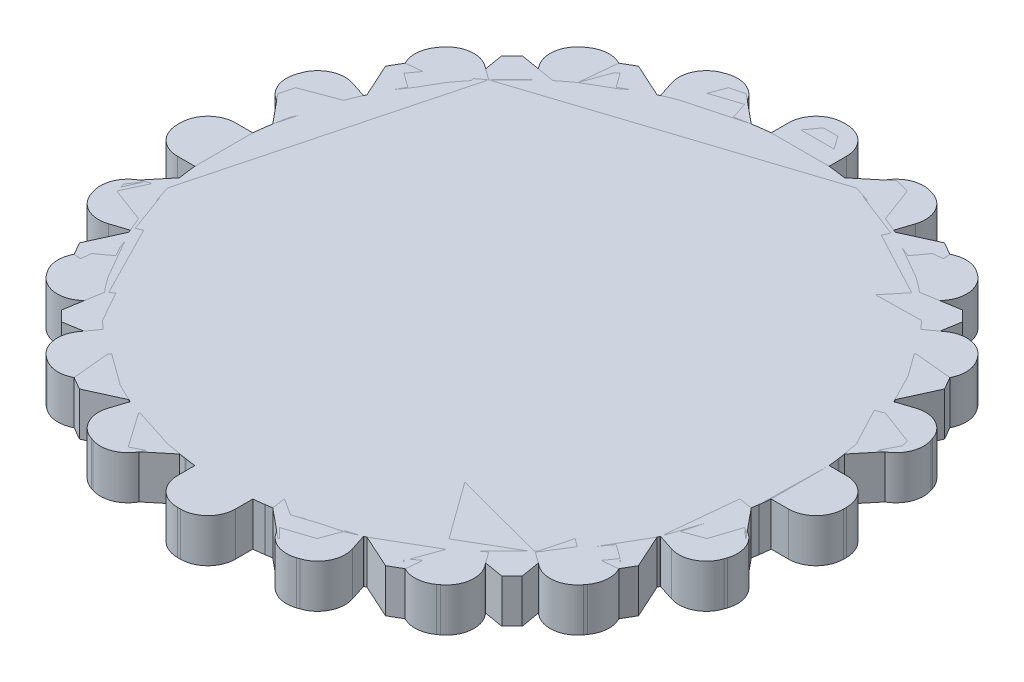
from build123d import *

# Parameters (mm, degrees)
BOSS_EXTRUDE3_DEPTH = 3
BOSS_EXTRUDE5_DEPTH = 3
BOSS_EXTRUDE6_DEPTH = 3
SKETCH4_R           = 4.125
CUT_EXTRUDE1_DEPTH  = 10


with BuildPart() as part:
    # Sketch2 → Boss-Extrude3 (new body)
    with BuildSketch(Plane(origin=(0, 0, 0), x_dir=(1, 0, 0), z_dir=(0, 1, 0))):
        with BuildLine():
            Line((-23, 0.1), (-23, -0.1))
            ThreePointArc((-23, -0.1), (-22.443502884, -1.443502884), (-21.1, -2))
            Line((-21.1, -2), (-19.899748742, -2))
            ThreePointArc((-19.899748742, -2), (-19.753766812, -3.128689301), (-19.543819703, -4.247247513))
            Line((-19.543819703, -4.247247513), (-20.685326483, -4.618145549))
            ThreePointArc((-20.685326483, -4.618145549), (-21.791106589, -5.56257098), (-21.905201574, -7.012285219))
            Line((-21.905201574, -7.012285219), (-21.843398175, -7.202496522))
            ThreePointArc((-21.843398175, -7.202496522), (-20.898972744, -8.308276629), (-19.449258505, -8.422371614))
            Line((-19.449258505, -8.422371614), (-18.307751725, -8.051473578))
            ThreePointArc((-18.307751725, -8.051473578), (-17.820130484, -9.079809995), (-17.274805421, -10.078744846))
            Line((-17.274805421, -10.078744846), (-18.245829086, -10.784234835))
            ThreePointArc((-18.245829086, -10.784234835), (-19.005644954, -12.02414164), (-18.666169396, -13.438159103))
            Line((-18.666169396, -13.438159103), (-18.548612345, -13.599962502))
            ThreePointArc((-18.548612345, -13.599962502), (-17.30870554, -14.35977837), (-15.894688077, -14.020302812))
            Line((-15.894688077, -14.020302812), (-14.923664412, -13.314812824))
            ThreePointArc((-14.923664412, -13.314812824), (-14.142135624, -14.142135624), (-13.314812824, -14.923664412))
            Line((-13.314812824, -14.923664412), (-14.020302812, -15.894688077))
            ThreePointArc((-14.020302812, -15.894688077), (-14.35977837, -17.30870554), (-13.599962502, -18.548612345))
            Line((-13.599962502, -18.548612345), (-13.438159103, -18.666169396))
            ThreePointArc((-13.438159103, -18.666169396), (-12.02414164, -19.005644954), (-10.784234835, -18.245829086))
            Line((-10.784234835, -18.245829086), (-10.078744846, -17.274805421))
            ThreePointArc((-10.078744846, -17.274805421), (-9.079809995, -17.820130484), (-8.051473578, -18.307751725))
            Line((-8.051473578, -18.307751725), (-8.422371614, -19.449258505))
            ThreePointArc((-8.422371614, -19.449258505), (-8.308276629, -20.898972744), (-7.202496522, -21.843398175))
            Line((-7.202496522, -21.843398175), (-7.012285219, -21.905201574))
            ThreePointArc((-7.012285219, -21.905201574), (-5.56257098, -21.791106589), (-4.618145549, -20.685326483))
            Line((-4.618145549, -20.685326483), (-4.247247513, -19.543819703))
            ThreePointArc((-4.247247513, -19.543819703), (-3.128689301, -19.753766812), (-2, -19.899748742))
            Line((-2, -19.899748742), (-2, -21.1))
            ThreePointArc((-2, -21.1), (-1.443502884, -22.443502884), (-0.1, -23))
            Line((-0.1, -23), (0.1, -23))
            ThreePointArc((0.1, -23), (1.443502884, -22.443502884), (2, -21.1))
            Line((2, -21.1), (2, -19.899748742))
            ThreePointArc((2, -19.899748742), (3.128689301, -19.753766812), (4.247247513, -19.543819703))
            Line((4.247247513, -19.543819703), (4.618145549, -20.685326483))
            ThreePointArc((4.618145549, -20.685326483), (5.56257098, -21.791106589), (7.012285219, -21.905201574))
            Line((7.012285219, -21.905201574), (7.202496522, -21.843398175))
            ThreePointArc((7.202496522, -21.843398175), (8.308276629, -20.898972744), (8.422371614, -19.449258505))
            Line((8.422371614, -19.449258505), (8.051473578, -18.307751725))
            ThreePointArc((8.051473578, -18.307751725), (9.079809995, -17.820130484), (10.078744846, -17.274805421))
            Line((10.078744846, -17.274805421), (10.784234835, -18.245829086))
            ThreePointArc((10.784234835, -18.245829086), (12.02414164, -19.005644954), (13.438159103, -18.666169396))
            Line((13.438159103, -18.666169396), (13.599962502, -18.548612345))
            ThreePointArc((13.599962502, -18.548612345), (14.35977837, -17.30870554), (14.020302812, -15.894688077))
            Line((14.020302812, -15.894688077), (13.314812824, -14.923664412))
            ThreePointArc((13.314812824, -14.923664412), (14.142135624, -14.142135624), (14.923664412, -13.314812824))
            Line((14.923664412, -13.314812824), (15.894688077, -14.020302812))
            ThreePointArc((15.894688077, -14.020302812), (17.30870554, -14.35977837), (18.548612345, -13.599962502))
            Line((18.548612345, -13.599962502), (18.666169396, -13.438159103))
            ThreePointArc((18.666169396, -13.438159103), (19.005644954, -12.02414164), (18.245829086, -10.784234835))
            Line((18.245829086, -10.784234835), (17.274805421, -10.078744846))
            ThreePointArc((17.274805421, -10.078744846), (17.820130484, -9.079809995), (18.307751725, -8.051473578))
            Line((18.307751725, -8.051473578), (19.449258505, -8.422371614))
            ThreePointArc((19.449258505, -8.422371614), (20.898972744, -8.308276629), (21.843398175, -7.202496522))
            Line((21.843398175, -7.202496522), (21.905201574, -7.012285219))
            ThreePointArc((21.905201574, -7.012285219), (21.791106589, -5.56257098), (20.685326483, -4.618145549))
            Line((20.685326483, -4.618145549), (19.543819703, -4.247247513))
            ThreePointArc((19.543819703, -4.247247513), (19.753766812, -3.128689301), (19.899748742, -2))
            Line((19.899748742, -2), (21.1, -2))
            ThreePointArc((21.1, -2), (22.443502884, -1.443502884), (23, -0.1))
            Line((23, -0.1), (23, 0.1))
            ThreePointArc((23, 0.1), (22.443502884, 1.443502884), (21.1, 2))
            Line((21.1, 2), (19.899748742, 2))
            ThreePointArc((19.899748742, 2), (19.753766812, 3.128689301), (19.543819703, 4.247247513))
            Line((19.543819703, 4.247247513), (20.685326483, 4.618145549))
            ThreePointArc((20.685326483, 4.618145549), (21.791106589, 5.56257098), (21.905201574, 7.012285219))
            Line((21.905201574, 7.012285219), (21.843398175, 7.202496522))
            ThreePointArc((21.843398175, 7.202496522), (20.898972744, 8.308276629), (19.449258505, 8.422371614))
            Line((19.449258505, 8.422371614), (18.307751725, 8.051473578))
            ThreePointArc((18.307751725, 8.051473578), (17.820130484, 9.079809995), (17.274805421, 10.078744846))
            Line((17.274805421, 10.078744846), (18.245829086, 10.784234835))
            ThreePointArc((18.245829086, 10.784234835), (19.005644954, 12.02414164), (18.666169396, 13.438159103))
            Line((18.666169396, 13.438159103), (18.548612345, 13.599962502))
            ThreePointArc((18.548612345, 13.599962502), (17.30870554, 14.35977837), (15.894688077, 14.020302812))
            Line((15.894688077, 14.020302812), (14.923664412, 13.314812824))
            ThreePointArc((14.923664412, 13.314812824), (14.142135624, 14.142135624), (13.314812824, 14.923664412))
            Line((13.314812824, 14.923664412), (14.020302812, 15.894688077))
            ThreePointArc((14.020302812, 15.894688077), (14.35977837, 17.30870554), (13.599962502, 18.548612345))
            Line((13.599962502, 18.548612345), (13.438159103, 18.666169396))
            ThreePointArc((13.438159103, 18.666169396), (12.02414164, 19.005644954), (10.784234835, 18.245829086))
            Line((10.784234835, 18.245829086), (10.078744846, 17.274805421))
            ThreePointArc((10.078744846, 17.274805421), (9.079809995, 17.820130484), (8.051473578, 18.307751725))
            Line((8.051473578, 18.307751725), (8.422371614, 19.449258505))
            ThreePointArc((8.422371614, 19.449258505), (8.308276629, 20.898972744), (7.202496522, 21.843398175))
            Line((7.202496522, 21.843398175), (7.012285219, 21.905201574))
            ThreePointArc((7.012285219, 21.905201574), (5.56257098, 21.791106589), (4.618145549, 20.685326483))
            Line((4.618145549, 20.685326483), (4.247247513, 19.543819703))
            ThreePointArc((4.247247513, 19.543819703), (3.128689301, 19.753766812), (2, 19.899748742))
            Line((2, 19.899748742), (2, 21.1))
            ThreePointArc((2, 21.1), (1.443502884, 22.443502884), (0.1, 23))
            Line((0.1, 23), (-0.1, 23))
            ThreePointArc((-0.1, 23), (-1.443502884, 22.443502884), (-2, 21.1))
            Line((-2, 21.1), (-2, 19.899748742))
            ThreePointArc((-2, 19.899748742), (-3.128689301, 19.753766812), (-4.247247513, 19.543819703))
            Line((-4.247247513, 19.543819703), (-4.618145549, 20.685326483))
            ThreePointArc((-4.618145549, 20.685326483), (-5.56257098, 21.791106589), (-7.012285219, 21.905201574))
            Line((-7.012285219, 21.905201574), (-7.202496522, 21.843398175))
            ThreePointArc((-7.202496522, 21.843398175), (-8.308276629, 20.898972744), (-8.422371614, 19.449258505))
            Line((-8.422371614, 19.449258505), (-8.051473578, 18.307751725))
            ThreePointArc((-8.051473578, 18.307751725), (-9.079809995, 17.820130484), (-10.078744846, 17.274805421))
            Line((-10.078744846, 17.274805421), (-10.784234835, 18.245829086))
            ThreePointArc((-10.784234835, 18.245829086), (-12.02414164, 19.005644954), (-13.438159103, 18.666169396))
            Line((-13.438159103, 18.666169396), (-13.599962502, 18.548612345))
            ThreePointArc((-13.599962502, 18.548612345), (-14.35977837, 17.30870554), (-14.020302812, 15.894688077))
            Line((-14.020302812, 15.894688077), (-13.314812824, 14.923664412))
            ThreePointArc((-13.314812824, 14.923664412), (-14.142135624, 14.142135624), (-14.923664412, 13.314812824))
            Line((-14.923664412, 13.314812824), (-15.894688077, 14.020302812))
            ThreePointArc((-15.894688077, 14.020302812), (-17.30870554, 14.35977837), (-18.548612345, 13.599962502))
            Line((-18.548612345, 13.599962502), (-18.666169396, 13.438159103))
            ThreePointArc((-18.666169396, 13.438159103), (-19.005644954, 12.02414164), (-18.245829086, 10.784234835))
            Line((-18.245829086, 10.784234835), (-17.274805421, 10.078744846))
            ThreePointArc((-17.274805421, 10.078744846), (-17.820130484, 9.079809995), (-18.307751725, 8.051473578))
            Line((-18.307751725, 8.051473578), (-19.449258505, 8.422371614))
            ThreePointArc((-19.449258505, 8.422371614), (-20.898972744, 8.308276629), (-21.843398175, 7.202496522))
            Line((-21.843398175, 7.202496522), (-21.905201574, 7.012285219))
            ThreePointArc((-21.905201574, 7.012285219), (-21.791106589, 5.56257098), (-20.685326483, 4.618145549))
            Line((-20.685326483, 4.618145549), (-19.543819703, 4.247247513))
            ThreePointArc((-19.543819703, 4.247247513), (-19.753766812, 3.128689301), (-19.899748742, 2))
            Line((-19.899748742, 2), (-21.1, 2))
            ThreePointArc((-21.1, 2), (-22.443502884, 1.443502884), (-23, 0.1))
        make_face()
    extrude(amount=BOSS_EXTRUDE3_DEPTH)


with BuildPart() as body_2:
    # Sketch3 → Boss-Extrude5 (new body)
    with BuildSketch(Plane(origin=(0, 0, 0), x_dir=(1, 0, 0), z_dir=(0, 1, 0))):
        with BuildLine():
            Line((-22, 0.5), (-22, -0.5))
            Line((-22, -0.5), (-19.899748742, -2))
            ThreePointArc((-19.899748742, -2), (-19.828897227, -2.610523844), (-19.739319337, -3.218582315))
            Line((-19.739319337, -3.218582315), (-21.379777701, -5.211056079))
            Line((-21.379777701, -5.211056079), (-21.120958656, -6.176981905))
            Line((-21.120958656, -6.176981905), (-18.704043156, -7.08228562))
            ThreePointArc((-18.704043156, -7.08228562), (-18.47759065, -7.653668647), (-18.23368794, -8.217823563))
            Line((-18.23368794, -8.217823563), (-19.302558883, -10.566987298))
            Line((-19.302558883, -10.566987298), (-18.802558883, -11.433012702))
            Line((-18.802558883, -11.433012702), (-16.23368794, -11.681925179))
            ThreePointArc((-16.23368794, -11.681925179), (-15.867066806, -12.17522858), (-15.485460842, -12.657033717))
            Line((-15.485460842, -12.657033717), (-15.909902577, -15.202795796))
            Line((-15.909902577, -15.202795796), (-15.202795796, -15.909902577))
            Line((-15.202795796, -15.909902577), (-12.657033717, -15.485460842))
            ThreePointArc((-12.657033717, -15.485460842), (-12.17522858, -15.867066806), (-11.681925179, -16.23368794))
            Line((-11.681925179, -16.23368794), (-11.433012702, -18.802558883))
            Line((-11.433012702, -18.802558883), (-10.566987298, -19.302558883))
            Line((-10.566987298, -19.302558883), (-8.217823563, -18.23368794))
            ThreePointArc((-8.217823563, -18.23368794), (-7.653668647, -18.47759065), (-7.08228562, -18.704043156))
            Line((-7.08228562, -18.704043156), (-6.176981905, -21.120958656))
            Line((-6.176981905, -21.120958656), (-5.211056079, -21.379777701))
            Line((-5.211056079, -21.379777701), (-3.218582315, -19.739319337))
            ThreePointArc((-3.218582315, -19.739319337), (-2.610523844, -19.828897227), (-2, -19.899748742))
            Line((-2, -19.899748742), (-0.5, -22))
            Line((-0.5, -22), (0.5, -22))
            Line((0.5, -22), (2, -19.899748742))
            ThreePointArc((2, -19.899748742), (2.610523844, -19.828897227), (3.218582315, -19.739319337))
            Line((3.218582315, -19.739319337), (5.211056079, -21.379777701))
            Line((5.211056079, -21.379777701), (6.176981905, -21.120958656))
            Line((6.176981905, -21.120958656), (7.08228562, -18.704043156))
            ThreePointArc((7.08228562, -18.704043156), (7.653668647, -18.47759065), (8.217823563, -18.23368794))
            Line((8.217823563, -18.23368794), (10.566987298, -19.302558883))
            Line((10.566987298, -19.302558883), (11.433012702, -18.802558883))
            Line((11.433012702, -18.802558883), (11.681925179, -16.23368794))
            ThreePointArc((11.681925179, -16.23368794), (12.17522858, -15.867066806), (12.657033717, -15.485460842))
            Line((12.657033717, -15.485460842), (15.202795796, -15.909902577))
            Line((15.202795796, -15.909902577), (15.909902577, -15.202795796))
            Line((15.909902577, -15.202795796), (15.485460842, -12.657033717))
            ThreePointArc((15.485460842, -12.657033717), (15.867066806, -12.17522858), (16.23368794, -11.681925179))
            Line((16.23368794, -11.681925179), (18.802558883, -11.433012702))
            Line((18.802558883, -11.433012702), (19.302558883, -10.566987298))
            Line((19.302558883, -10.566987298), (18.23368794, -8.217823563))
            ThreePointArc((18.23368794, -8.217823563), (18.47759065, -7.653668647), (18.704043156, -7.08228562))
            Line((18.704043156, -7.08228562), (21.120958656, -6.176981905))
            Line((21.120958656, -6.176981905), (21.379777701, -5.211056079))
            Line((21.379777701, -5.211056079), (19.739319337, -3.218582315))
            ThreePointArc((19.739319337, -3.218582315), (19.828897227, -2.610523844), (19.899748742, -2))
            Line((19.899748742, -2), (22, -0.5))
            Line((22, -0.5), (22, 0.5))
            Line((22, 0.5), (19.899748742, 2))
            ThreePointArc((19.899748742, 2), (19.828897227, 2.610523844), (19.739319337, 3.218582315))
            Line((19.739319337, 3.218582315), (21.379777701, 5.211056079))
            Line((21.379777701, 5.211056079), (21.120958656, 6.176981905))
            Line((21.120958656, 6.176981905), (18.704043156, 7.08228562))
            ThreePointArc((18.704043156, 7.08228562), (18.47759065, 7.653668647), (18.23368794, 8.217823563))
            Line((18.23368794, 8.217823563), (19.302558883, 10.566987298))
            Line((19.302558883, 10.566987298), (18.802558883, 11.433012702))
            Line((18.802558883, 11.433012702), (16.23368794, 11.681925179))
            ThreePointArc((16.23368794, 11.681925179), (15.867066806, 12.17522858), (15.485460842, 12.657033717))
            Line((15.485460842, 12.657033717), (15.909902577, 15.202795796))
            Line((15.909902577, 15.202795796), (15.202795796, 15.909902577))
            Line((15.202795796, 15.909902577), (12.657033717, 15.485460842))
            ThreePointArc((12.657033717, 15.485460842), (12.17522858, 15.867066806), (11.681925179, 16.23368794))
            Line((11.681925179, 16.23368794), (11.433012702, 18.802558883))
            Line((11.433012702, 18.802558883), (10.566987298, 19.302558883))
            Line((10.566987298, 19.302558883), (8.217823563, 18.23368794))
            ThreePointArc((8.217823563, 18.23368794), (7.653668647, 18.47759065), (7.08228562, 18.704043156))
            Line((7.08228562, 18.704043156), (6.176981905, 21.120958656))
            Line((6.176981905, 21.120958656), (5.211056079, 21.379777701))
            Line((5.211056079, 21.379777701), (3.218582315, 19.739319337))
            ThreePointArc((3.218582315, 19.739319337), (2.610523844, 19.828897227), (2, 19.899748742))
            Line((2, 19.899748742), (0.5, 22))
            Line((0.5, 22), (-0.5, 22))
            Line((-0.5, 22), (-2, 19.899748742))
            ThreePointArc((-2, 19.899748742), (-2.610523844, 19.828897227), (-3.218582315, 19.739319337))
            Line((-3.218582315, 19.739319337), (-5.211056079, 21.379777701))
            Line((-5.211056079, 21.379777701), (-6.176981905, 21.120958656))
            Line((-6.176981905, 21.120958656), (-7.08228562, 18.704043156))
            ThreePointArc((-7.08228562, 18.704043156), (-7.653668647, 18.47759065), (-8.217823563, 18.23368794))
            Line((-8.217823563, 18.23368794), (-10.566987298, 19.302558883))
            Line((-10.566987298, 19.302558883), (-11.433012702, 18.802558883))
            Line((-11.433012702, 18.802558883), (-11.681925179, 16.23368794))
            ThreePointArc((-11.681925179, 16.23368794), (-12.17522858, 15.867066806), (-12.657033717, 15.485460842))
            Line((-12.657033717, 15.485460842), (-15.202795796, 15.909902577))
            Line((-15.202795796, 15.909902577), (-15.909902577, 15.202795796))
            Line((-15.909902577, 15.202795796), (-15.485460842, 12.657033717))
            ThreePointArc((-15.485460842, 12.657033717), (-15.867066806, 12.17522858), (-16.23368794, 11.681925179))
            Line((-16.23368794, 11.681925179), (-18.802558883, 11.433012702))
            Line((-18.802558883, 11.433012702), (-19.302558883, 10.566987298))
            Line((-19.302558883, 10.566987298), (-18.23368794, 8.217823563))
            ThreePointArc((-18.23368794, 8.217823563), (-18.47759065, 7.653668647), (-18.704043156, 7.08228562))
            Line((-18.704043156, 7.08228562), (-21.120958656, 6.176981905))
            Line((-21.120958656, 6.176981905), (-21.379777701, 5.211056079))
            Line((-21.379777701, 5.211056079), (-19.739319337, 3.218582315))
            ThreePointArc((-19.739319337, 3.218582315), (-19.828897227, 2.610523844), (-19.899748742, 2))
            Line((-19.899748742, 2), (-22, 0.5))
        make_face()
    extrude(amount=BOSS_EXTRUDE5_DEPTH)

    # Sketch4 → Cut-Extrude1 (cut)
    with BuildSketch(Plane(origin=(0, 3, 0), x_dir=(1, 0, 0), z_dir=(0, 1, 0))):
        Circle(SKETCH4_R)
    extrude(amount=-CUT_EXTRUDE1_DEPTH, mode=Mode.SUBTRACT)


with BuildPart() as body_3:
    # Sketch1 → Boss-Extrude6 (new body)
    with BuildSketch(Plane(origin=(0, 0, 0), x_dir=(1, 0, 0), z_dir=(0, 1, 0))):
        with BuildLine():
            Line((-0.5, 14.746169466), (0.5, 14.746169466))
            Line((0.5, 14.746169466), (2, 12.544128437))
            ThreePointArc((2, 12.544128437), (2.588190451, 12.405427729), (3.166928678, 12.23145084))
            Line((3.166928678, 12.23145084), (5.566987298, 13.388474311))
            Line((5.566987298, 13.388474311), (6.433012702, 12.888474311))
            Line((6.433012702, 12.888474311), (6.631030293, 10.23145084))
            ThreePointArc((6.631030293, 10.23145084), (7.071067812, 9.817237278), (7.485281374, 9.377199759))
            Line((7.485281374, 9.377199759), (10.142304845, 9.179182168))
            Line((10.142304845, 9.179182168), (10.642304845, 8.313156764))
            Line((10.642304845, 8.313156764), (9.485281374, 5.913098144))
            ThreePointArc((9.485281374, 5.913098144), (9.659258263, 5.334359917), (9.797958971, 4.746169466))
            Line((9.797958971, 4.746169466), (12, 3.246169466))
            Line((12, 3.246169466), (12, 2.246169466))
            Line((12, 2.246169466), (9.797958971, 0.746169466))
            ThreePointArc((9.797958971, 0.746169466), (9.659258263, 0.157979015), (9.485281374, -0.420759212))
            Line((9.485281374, -0.420759212), (10.642304845, -2.820817832))
            Line((10.642304845, -2.820817832), (10.142304845, -3.686843236))
            Line((10.142304845, -3.686843236), (7.485281374, -3.884860827))
            ThreePointArc((7.485281374, -3.884860827), (7.071067812, -4.324898346), (6.631030293, -4.739111908))
            Line((6.631030293, -4.739111908), (6.433012702, -7.39613538))
            Line((6.433012702, -7.39613538), (5.566987298, -7.89613538))
            Line((5.566987298, -7.89613538), (3.166928678, -6.739111908))
            ThreePointArc((3.166928678, -6.739111908), (2.588190451, -6.913088797), (2, -7.051789505))
            Line((2, -7.051789505), (0.5, -9.253830534))
            Line((0.5, -9.253830534), (-0.5, -9.253830534))
            Line((-0.5, -9.253830534), (-2, -7.051789505))
            ThreePointArc((-2, -7.051789505), (-2.588190451, -6.913088797), (-3.166928678, -6.739111908))
            Line((-3.166928678, -6.739111908), (-5.566987298, -7.89613538))
            Line((-5.566987298, -7.89613538), (-6.433012702, -7.39613538))
            Line((-6.433012702, -7.39613538), (-6.631030293, -4.739111908))
            ThreePointArc((-6.631030293, -4.739111908), (-7.071067812, -4.324898346), (-7.485281374, -3.884860827))
            Line((-7.485281374, -3.884860827), (-10.142304845, -3.686843236))
            Line((-10.142304845, -3.686843236), (-10.642304845, -2.820817832))
            Line((-10.642304845, -2.820817832), (-9.485281374, -0.420759212))
            ThreePointArc((-9.485281374, -0.420759212), (-9.659258263, 0.157979015), (-9.797958971, 0.746169466))
            Line((-9.797958971, 0.746169466), (-12, 2.246169466))
            Line((-12, 2.246169466), (-12, 3.246169466))
            Line((-12, 3.246169466), (-9.797958971, 4.746169466))
            ThreePointArc((-9.797958971, 4.746169466), (-9.659258263, 5.334359917), (-9.485281374, 5.913098144))
            Line((-9.485281374, 5.913098144), (-10.642304845, 8.313156764))
            Line((-10.642304845, 8.313156764), (-10.142304845, 9.179182168))
            Line((-10.142304845, 9.179182168), (-7.485281374, 9.377199759))
            ThreePointArc((-7.485281374, 9.377199759), (-7.071067812, 9.817237278), (-6.631030293, 10.23145084))
            Line((-6.631030293, 10.23145084), (-6.433012702, 12.888474311))
            Line((-6.433012702, 12.888474311), (-5.566987298, 13.388474311))
            Line((-5.566987298, 13.388474311), (-3.166928678, 12.23145084))
            ThreePointArc((-3.166928678, 12.23145084), (-2.588190451, 12.405427729), (-2, 12.544128437))
            Line((-2, 12.544128437), (-0.5, 14.746169466))
        make_face()
    extrude(amount=BOSS_EXTRUDE6_DEPTH)


solid = Compound([part.part, body_2.part, body_3.part])
